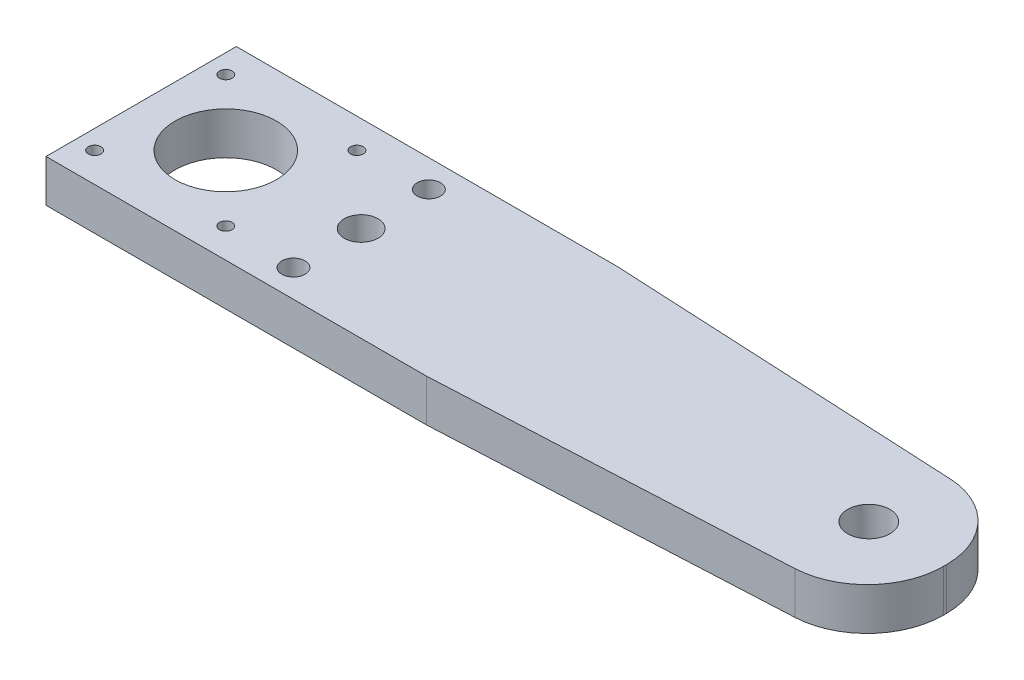
from build123d import *

# Parameters (mm, degrees)
SKETCH1_W           = 190
SKETCH1_H           = 45
BOSS_EXTRUDE1_DEPTH = 10
SKETCH2_R           = 1.5
SKETCH2_R_2         = 12
SKETCH2_R_3         = 4
SKETCH2_R_4         = 2.75
SKETCH2_R_5         = 5
CUT_EXTRUDE1_DEPTH  = 10
CUT_EXTRUDE2_DEPTH  = 10
FILLET1_R           = 18


with BuildPart() as part:
    # Sketch1 → Boss-Extrude1 (new body)
    with BuildSketch(Plane(origin=(0, 0, 0), x_dir=(1, 0, 0), z_dir=(0, 1, 0))):
        Rectangle(SKETCH1_W, SKETCH1_H)
    extrude(amount=BOSS_EXTRUDE1_DEPTH)

    # Sketch2 → Cut-Extrude1 (cut)
    with BuildSketch(Plane(origin=(0, 10, 0), x_dir=(1, 0, 0), z_dir=(0, 1, 0))):
        with Locations((-90.5, 15.5)):
            Circle(SKETCH2_R)
        with Locations((-59.5, 15.5)):
            Circle(SKETCH2_R)
        with Locations((-90.5, -15.5)):
            Circle(SKETCH2_R)
        with Locations((-59.5, -15.5)):
            Circle(SKETCH2_R)
        with Locations((-75, 0)):
            Circle(SKETCH2_R_2)
        with Locations((-43, 0)):
            Circle(SKETCH2_R_3)
        with Locations((-43, 16)):
            Circle(SKETCH2_R_4)
        with Locations((-43, -16)):
            Circle(SKETCH2_R_4)
        with Locations((77, 0)):
            Circle(SKETCH2_R_5)
    extrude(amount=-CUT_EXTRUDE1_DEPTH, mode=Mode.SUBTRACT)

    # Sketch3 → Cut-Extrude2 (cut)
    with BuildSketch(Plane(origin=(0, 10, 0), x_dir=(1, 0, 0), z_dir=(0, 1, 0))):
        Polygon((95, -22.5), (-5, -22.5), (95, -17.5), align=None)
        Polygon((-5, 22.5), (95, 17.5), (95, 22.5), align=None)
    extrude(amount=-CUT_EXTRUDE2_DEPTH, mode=Mode.SUBTRACT)

    # Fillet1
    fillet1_edges = [part.edges().sort_by_distance(p)[0] for p in [
        (95, 5, -17.5),
        (95, 5, 17.5),
    ]]
    fillet(fillet1_edges, radius=FILLET1_R)


solid = part.part
